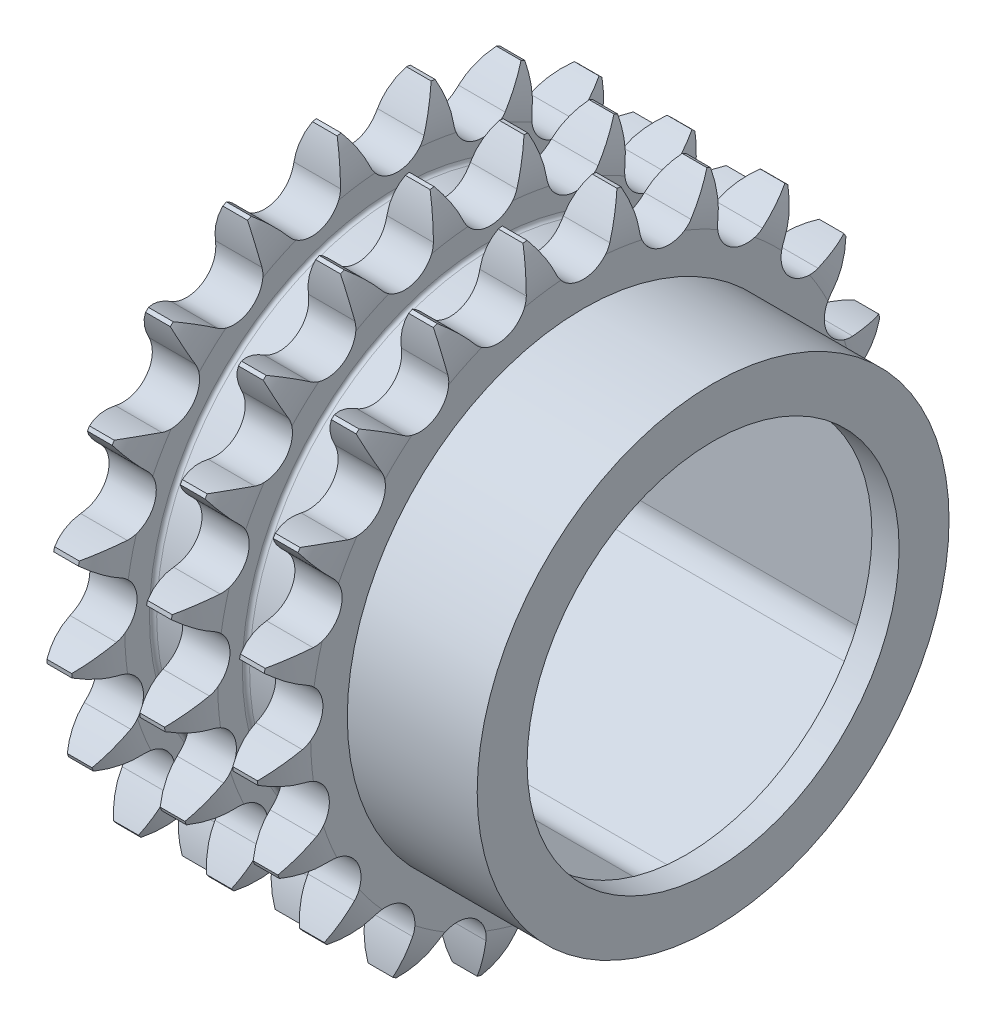
from build123d import *

# Parameters (mm, degrees)
GROOVES_COUNT       = 2
GROOVES_PITCH       = 10.24
TOOTHCUT_DEPTH      = 56.428997034
TEETHCUTS_COUNT     = 21
TEETHCUTS_ANGLE     = 342.857142857
BORSKE_R            = 2
BORE_DEPTH          = 50.0005
CUT_EXTRUDE1_DEPTH  = 56.378188951
FILLET1_R           = 3
SKETCH2_R           = 26
BOSS_EXTRUDE1_DEPTH = 14.3148
BOSS_EXTRUDE2_START = 37
SKETCH3_R           = 26
SKETCH3_R_2         = 20.5
BOSS_EXTRUDE2_DEPTH = 3


with BuildPart() as part:
    # BasProSke → Base-Revolve (revolve)
    with BuildSketch(Plane(origin=(0, 0, 0), x_dir=(1, 0, 0), z_dir=(0, 1, 0)), mode=Mode.PRIVATE) as base_revolve_sk:
        with BuildLine():
            Line((0, 0), (0, 30.036271538))
            ThreePointArc((0, 30.036271538), (0.314698702, 32.464434424), (1.238, 34.732148027))
            Line((1.238, 34.732148027), (24.4472, 34.732148027))
            ThreePointArc((24.4472, 34.732148027), (25.370501298, 32.464434424), (25.6852, 30.036271538))
            Line((25.6852, 30.036271538), (25.6852, 0))
            Line((25.6852, 0), (0, 0))
        make_face()
    revolve(base_revolve_sk.sketch.rotate(Axis((-10, 0, 0), (1, 0, 0)), 180), axis=Axis((-10, 0, 0), (1, 0, 0)))

    # GrvSke → Groove (revolve, cut)
    with BuildSketch(Plane(origin=(0, 0, 0), x_dir=(1, 0, 0), z_dir=(0, 1, 0)), mode=Mode.PRIVATE) as groove_sk:
        with BuildLine():
            Line((5.2052, 30.036271538), (5.2052, 27.321922992))
            ThreePointArc((5.2052, 27.321922992), (5.322357288, 27.039080279), (5.6052, 26.921922992))
            Line((5.6052, 26.921922992), (9.84, 26.921922992))
            ThreePointArc((9.84, 26.921922992), (10.122842712, 27.039080279), (10.24, 27.321922992))
            Line((10.24, 27.321922992), (10.24, 30.036271538))
            ThreePointArc((10.24, 30.036271538), (10.554698702, 32.464434424), (11.478, 34.732148027))
            Line((11.478, 34.732148027), (3.9672, 34.732148027))
            ThreePointArc((3.9672, 34.732148027), (4.890501298, 32.464434424), (5.2052, 30.036271538))
        make_face()
    groove = revolve(groove_sk.sketch.rotate(Axis((0, 0, 0), (1, 0, 0)), 180), axis=Axis((0, 0, 0), (1, 0, 0)), mode=Mode.SUBTRACT)

    # Grooves: Groove ×2
    with Locations(*[(i * GROOVES_PITCH, 0, 0) for i in range(1, GROOVES_COUNT)]):
        add(groove, mode=Mode.SUBTRACT)

    # TooCutSke → ToothCut (cut, through all)
    with BuildSketch(Plane(origin=(0, 0, 0), x_dir=(0, 0, -1), z_dir=(1, 0, 0))):
        with BuildLine():
            ThreePointArc((2.970242428, 30.777093797), (3.995903383, 32.882455419), (5.293107213, 34.832273406))
            ThreePointArc((5.293107213, 34.832273406), (0, 35.232148027), (-5.293107213, 34.832273406))
            ThreePointArc((-5.293107213, 34.832273406), (-3.995903383, 32.882455419), (-2.970242428, 30.777093797))
            ThreePointArc((-2.970242428, 30.777093797), (0, 28.779023027), (2.970242428, 30.777093797))
        make_face()
    toothcut = extrude(amount=TOOTHCUT_DEPTH, mode=Mode.SUBTRACT)

    # TeethCuts: ToothCut ×21 about axis
    teethcuts_axis = Axis((-10, 0, 0), (1, 0, 0))
    for i in range(1, TEETHCUTS_COUNT):
        add(toothcut.rotate(teethcuts_axis, i * TEETHCUTS_ANGLE / (TEETHCUTS_COUNT - 1)), mode=Mode.SUBTRACT)

    # BorSke → Bore (cut, symmetric)
    with BuildSketch(Plane(origin=(0, 0, 0), x_dir=(0, 0, -1), z_dir=(1, 0, 0))):
        with Locations(Location((0, 0, 0), (0, 0, 180))):
            Circle(BORSKE_R)
    extrude(amount=BORE_DEPTH, both=True, mode=Mode.SUBTRACT)

    # Sketch1 → Cut-Extrude1 (cut, through all)
    with BuildSketch(Plane(origin=(25.6852, 0, 0), x_dir=(0, 0, -1), z_dir=(1, 0, 0))):
        Polygon((-21.5, -12.413030788), (0, -24.826061575), (21.5, -12.413030788), (21.5, 12.413030788), (0, 24.826061575), (-21.5, 12.413030788), align=None)
    extrude(amount=-CUT_EXTRUDE1_DEPTH, mode=Mode.SUBTRACT)

    # Fillet1
    fillet1_edges = [part.edges().sort_by_distance(p)[0] for p in [
        (12.8426, -12.413030788, 21.5),
        (12.8426, 12.413030788, 21.5),
        (12.8426, 24.826061575, 0),
        (12.8426, 12.413030788, -21.5),
        (12.8426, -12.413030788, -21.5),
        (12.8426, -24.826061575, 0),
    ]]
    fillet(fillet1_edges, radius=FILLET1_R)

    # Sketch2 → Boss-Extrude1 (add)
    with BuildSketch(Plane(origin=(25.6852, 0, 0), x_dir=(0, 0, -1), z_dir=(1, 0, 0))):
        with Locations(Location((0, 0, 0), (0, 0, 180))):
            Circle(SKETCH2_R)
        with BuildLine():
            Line((-20, -13.279056191), (-1.5, -23.960036171))
            ThreePointArc((-1.5, -23.960036171), (0, -24.36195996), (1.5, -23.960036171))
            Line((1.5, -23.960036171), (20, -13.279056191))
            ThreePointArc((20, -13.279056191), (21.098076211, -12.18097998), (21.5, -10.68097998))
            Line((21.5, -10.68097998), (21.5, 10.68097998))
            ThreePointArc((21.5, 10.68097998), (21.098076211, 12.18097998), (20, 13.279056191))
            Line((20, 13.279056191), (1.5, 23.960036171))
            ThreePointArc((1.5, 23.960036171), (0, 24.36195996), (-1.5, 23.960036171))
            Line((-1.5, 23.960036171), (-20, 13.279056191))
            ThreePointArc((-20, 13.279056191), (-21.098076211, 12.18097998), (-21.5, 10.68097998))
            Line((-21.5, 10.68097998), (-21.5, -10.68097998))
            ThreePointArc((-21.5, -10.68097998), (-21.098076211, -12.18097998), (-20, -13.279056191))
        make_face(mode=Mode.SUBTRACT)
    extrude(amount=BOSS_EXTRUDE1_DEPTH)

    # Sketch3 → Boss-Extrude2 (add)
    with BuildSketch(Plane(origin=(0, 0, 0), x_dir=(0, 0, -1), z_dir=(1, 0, 0)).offset(BOSS_EXTRUDE2_START)):
        with Locations(Location((0, 0, 0), (0, 0, 180))):
            Circle(SKETCH3_R)
        Circle(SKETCH3_R_2, mode=Mode.SUBTRACT)
    extrude(amount=BOSS_EXTRUDE2_DEPTH)


solid = part.part
